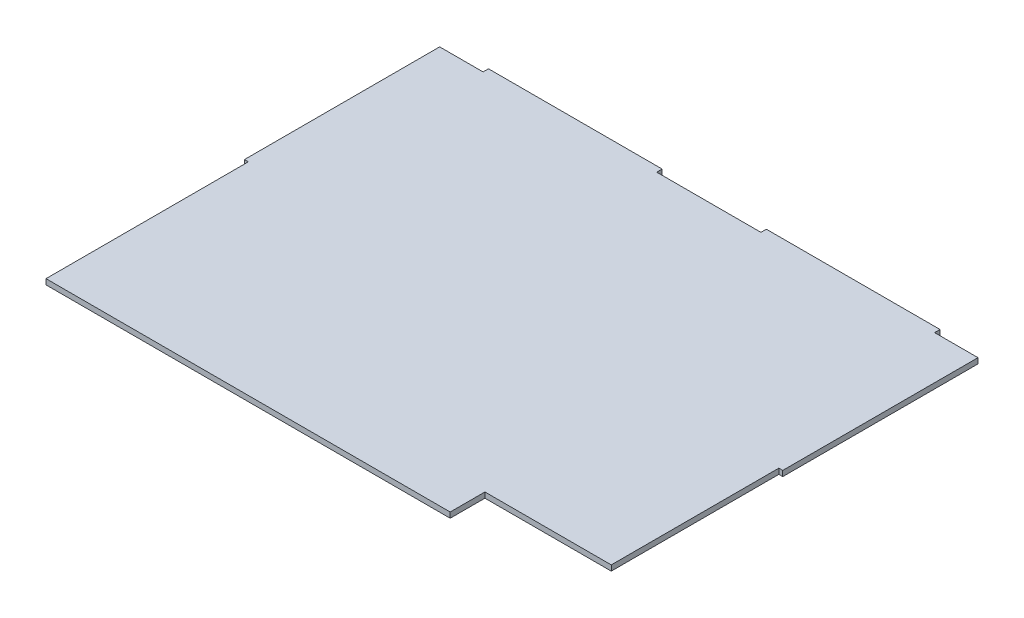
from build123d import *

# Parameters (mm, degrees)
SKETCH1_W           = 314.96461264
SKETCH1_H           = 3.175
BOSS_EXTRUDE1_DEPTH = 235.775
SKETCH3_W           = 25.4
SKETCH3_H           = 3.175
SKETCH3_W_2         = 60.96461264
CUT_EXTRUDE1_DEPTH  = 3.175
CUT_EXTRUDE2_START  = -3.175
SKETCH5_W           = 2.286
SKETCH5_H           = 118.364
CUT_EXTRUDE2_DEPTH  = 287.725009793
SKETCH8_W           = 76.2
SKETCH8_H           = 20.32
CUT_EXTRUDE6_DEPTH  = 284.550009793


with BuildPart() as part:
    # Sketch1 → Boss-Extrude1 (new body)
    with BuildSketch(Plane.XY):
        Rectangle(SKETCH1_W, SKETCH1_H)
    extrude(amount=BOSS_EXTRUDE1_DEPTH)

    # Sketch3 → Cut-Extrude1 (cut)
    with BuildSketch(Plane(origin=(0, 0, 0), x_dir=(-1, 0, 0), z_dir=(0, 0, -1))):
        with Locations((-144.78230632, 0)):
            Rectangle(SKETCH3_W, SKETCH3_H)
        Rectangle(SKETCH3_W_2, SKETCH3_H)
        with Locations((144.78230632, 0)):
            Rectangle(SKETCH3_W, SKETCH3_H)
    extrude(amount=-CUT_EXTRUDE1_DEPTH, mode=Mode.SUBTRACT)

    # Sketch5 → Cut-Extrude2 (cut)
    with BuildSketch(Plane(origin=(0, 1.5875, 0), x_dir=(1, 0, 0), z_dir=(0, 1, 0)).offset(CUT_EXTRUDE2_START)):
        with Locations((-156.33930632, -176.593)):
            Rectangle(SKETCH5_W, SKETCH5_H)
    cut_extrude2 = extrude(amount=CUT_EXTRUDE2_DEPTH, mode=Mode.SUBTRACT)

    # Mirror1: Cut-Extrude2 across plane
    add(cut_extrude2.mirror(Plane(origin=(0, 0, 0), x_dir=(0, 0, 1), z_dir=(1, 0, 0))), mode=Mode.SUBTRACT)

    # Sketch8 → Cut-Extrude6 (cut, through all)
    with BuildSketch(Plane(origin=(0, 1.5875, 0), x_dir=(1, 0, 0), z_dir=(0, 1, 0))):
        with Locations((119.38230632, -225.615)):
            Rectangle(SKETCH8_W, SKETCH8_H)
    extrude(amount=-CUT_EXTRUDE6_DEPTH, mode=Mode.SUBTRACT)


solid = part.part
